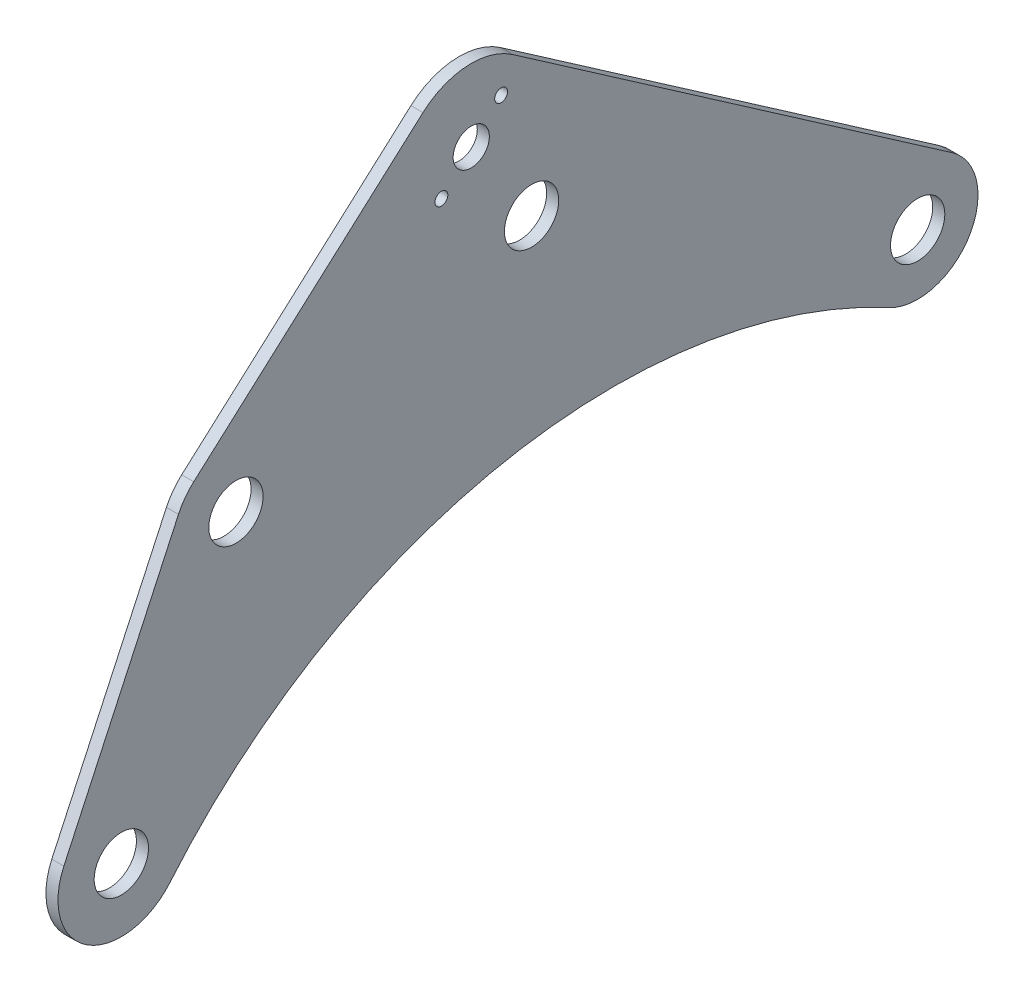
from build123d import *

# Parameters (mm, degrees)
BOSS_EXTRUDE1_DEPTH = 6.35
CUT_EXTRUDE1_REACH  = 494.039
SKETCH3_R           = 14.2875
SKETCH3_R_2         = 9.525
SKETCH3_R_3         = 3.3782


with BuildPart() as part:
    # Sketch2 → Boss-Extrude1 (new body)
    with BuildSketch(Plane(origin=(0, 0, 0), x_dir=(0, 0, -1), z_dir=(1, 0, 0))):
        with BuildLine():
            Line((-449.347467345, -65.357880986), (-389.022467345, 64.817119014))
            ThreePointArc((-389.022467345, 64.817119014), (-385.565758877, 70.64046736), (-381.003559726, 75.645121025))
            Line((-381.003559726, 75.645121025), (-260.354068258, 183.588424029))
            ThreePointArc((-260.354068258, 183.588424029), (-237.302476246, 193.221304079), (-213.239358387, 186.503072818))
            Line((-213.239358387, 186.503072818), (18.092201344, 26.090894015))
            ThreePointArc((18.092201344, 26.090894015), (27.062234396, -16.604155188), (-15.064096059, -27.948801583))
            ThreePointArc((-15.064096059, -27.948801583), (-217.26171717, 3.054111034), (-393.523322923, -100.757761654))
            ThreePointArc((-393.523322923, -100.757761654), (-436.953345856, -107.52898636), (-449.347467345, -65.357880986))
        make_face()
    extrude(amount=BOSS_EXTRUDE1_DEPTH)

    # Sketch3 → Cut-Extrude1 (cut, up to next)
    with BuildSketch(Plane(origin=(6.35, 0, 0), x_dir=(0, 0, -1), z_dir=(1, 0, 0)), mode=Mode.PRIVATE) as cut_extrude1_sk1:
        with Locations((-203.2, 107.95)):
            Circle(SKETCH3_R)
    cut_extrude1_tool1 = extrude(cut_extrude1_sk1.sketch, amount=-CUT_EXTRUDE1_REACH, mode=Mode.PRIVATE) & part.part
    # Sketch3 → Cut-Extrude1 (cut, up to next)
    with BuildSketch(Plane(origin=(6.35, 0, 0), x_dir=(0, 0, -1), z_dir=(1, 0, 0)), mode=Mode.PRIVATE) as cut_extrude1_sk2:
        with Locations((-358.775, 50.8)):
            Circle(SKETCH3_R)
    cut_extrude1_tool2 = extrude(cut_extrude1_sk2.sketch, amount=-CUT_EXTRUDE1_REACH, mode=Mode.PRIVATE) & part.part
    # Sketch3 → Cut-Extrude1 (cut, up to next)
    with BuildSketch(Plane(origin=(6.35, 0, 0), x_dir=(0, 0, -1), z_dir=(1, 0, 0)), mode=Mode.PRIVATE) as cut_extrude1_sk3:
        with Locations((-419.1, -79.375)):
            Circle(SKETCH3_R)
    cut_extrude1_tool3 = extrude(cut_extrude1_sk3.sketch, amount=-CUT_EXTRUDE1_REACH, mode=Mode.PRIVATE) & part.part
    # Sketch3 → Cut-Extrude1 (cut, up to next)
    with BuildSketch(Plane(origin=(6.35, 0, 0), x_dir=(0, 0, -1), z_dir=(1, 0, 0)), mode=Mode.PRIVATE) as cut_extrude1_sk4:
        with Locations((-234.95, 155.194)):
            Circle(SKETCH3_R_2)
    cut_extrude1_tool4 = extrude(cut_extrude1_sk4.sketch, amount=-CUT_EXTRUDE1_REACH, mode=Mode.PRIVATE) & part.part
    # Sketch3 → Cut-Extrude1 (cut, up to next)
    with BuildSketch(Plane(origin=(6.35, 0, 0), x_dir=(0, 0, -1), z_dir=(1, 0, 0)), mode=Mode.PRIVATE) as cut_extrude1_sk5:
        Circle(SKETCH3_R)
    cut_extrude1_tool5 = extrude(cut_extrude1_sk5.sketch, amount=-CUT_EXTRUDE1_REACH, mode=Mode.PRIVATE) & part.part
    # Sketch3 → Cut-Extrude1 (cut, up to next)
    with BuildSketch(Plane(origin=(6.35, 0, 0), x_dir=(0, 0, -1), z_dir=(1, 0, 0)), mode=Mode.PRIVATE) as cut_extrude1_sk6:
        with Locations((-250.665448212, 139.478551788)):
            Circle(SKETCH3_R_3)
    cut_extrude1_tool6 = extrude(cut_extrude1_sk6.sketch, amount=-CUT_EXTRUDE1_REACH, mode=Mode.PRIVATE) & part.part
    # Sketch3 → Cut-Extrude1 (cut, up to next)
    with BuildSketch(Plane(origin=(6.35, 0, 0), x_dir=(0, 0, -1), z_dir=(1, 0, 0)), mode=Mode.PRIVATE) as cut_extrude1_sk7:
        with Locations((-219.234551788, 170.909448212)):
            Circle(SKETCH3_R_3)
    cut_extrude1_tool7 = extrude(cut_extrude1_sk7.sketch, amount=-CUT_EXTRUDE1_REACH, mode=Mode.PRIVATE) & part.part
    add(cut_extrude1_tool1.solids().sort_by_distance((6.35, 107.95, 203.2))[0], mode=Mode.SUBTRACT)
    add(cut_extrude1_tool2.solids().sort_by_distance((6.35, 50.8, 358.775))[0], mode=Mode.SUBTRACT)
    add(cut_extrude1_tool3.solids().sort_by_distance((6.35, -79.375, 419.1))[0], mode=Mode.SUBTRACT)
    add(cut_extrude1_tool4.solids().sort_by_distance((6.35, 155.194, 234.95))[0], mode=Mode.SUBTRACT)
    add(cut_extrude1_tool5.solids().sort_by_distance((6.35, 0, 0))[0], mode=Mode.SUBTRACT)
    add(cut_extrude1_tool6.solids().sort_by_distance((6.35, 139.478552, 250.665448))[0], mode=Mode.SUBTRACT)
    add(cut_extrude1_tool7.solids().sort_by_distance((6.35, 170.909448, 219.234552))[0], mode=Mode.SUBTRACT)


solid = part.part
